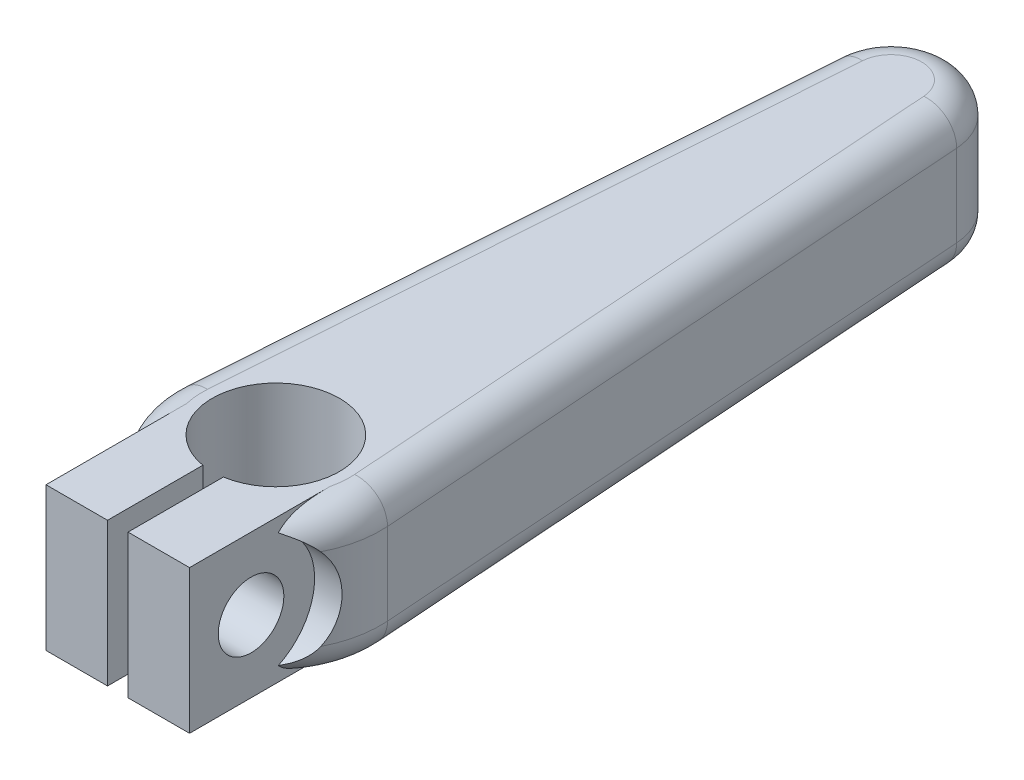
from build123d import *

# Parameters (mm, degrees)
BOSS_EXTRUDE1_DEPTH = 7
SKETCH2_R           = 1.6
CUT_EXTRUDE1_DEPTH  = 35.813215881
SKETCH3_R           = 3.1
CUT_EXTRUDE2_DEPTH  = 35.813215926
SKETCH4_R           = 3.1
CUT_EXTRUDE3_DEPTH  = 35.813215926
FILLET1_R           = 1.5


with BuildPart() as part:
    # Sketch1 → Boss-Extrude1 (new body)
    with BuildSketch(Plane(origin=(0, 0, 0), x_dir=(1, 0, 0), z_dir=(0, 1, 0))):
        with BuildLine():
            Line((3.5, -7.709447398), (3.5, -3.709447398))
            ThreePointArc((3.5, -3.709447398), (4.75081501, -1.85465812), (5.087489656, 0.357))
            Line((5.087489656, 0.357), (2.992640974, 30.21))
            ThreePointArc((2.992640974, 30.21), (0, 33), (-2.992640974, 30.21))
            Line((-2.992640974, 30.21), (-5.087489656, 0.357))
            ThreePointArc((-5.087489656, 0.357), (-4.75081501, -1.85465812), (-3.5, -3.709447398))
            Line((-3.5, -3.709447398), (-3.5, -7.709447398))
            Line((-3.5, -7.709447398), (-0.5, -7.709447398))
            Line((-0.5, -7.709447398), (-0.5, -3.059411708))
            ThreePointArc((-0.5, -3.059411708), (0, 3.1), (0.5, -3.059411708))
            Line((0.5, -3.059411708), (0.5, -7.709447398))
            Line((0.5, -7.709447398), (3.5, -7.709447398))
        make_face()
    extrude(amount=BOSS_EXTRUDE1_DEPTH)

    # Sketch2 → Cut-Extrude1 (cut, through all)
    with BuildSketch(Plane(origin=(3.5, 0, 0), x_dir=(0, 0, -1), z_dir=(1, 0, 0))):
        with Locations((-4.709447398, 3.5)):
            Circle(SKETCH2_R)
    extrude(amount=-CUT_EXTRUDE1_DEPTH, mode=Mode.SUBTRACT)

    # Sketch3 → Cut-Extrude2 (cut, through all)
    with BuildSketch(Plane(origin=(3.5, 0, 0), x_dir=(0, 0, -1), z_dir=(1, 0, 0))):
        with Locations((-4.709447398, 3.5)):
            Circle(SKETCH3_R)
    extrude(amount=CUT_EXTRUDE2_DEPTH, mode=Mode.SUBTRACT)

    # Sketch4 → Cut-Extrude3 (cut, through all)
    with BuildSketch(Plane.ZY.offset(3.5)):
        with Locations((4.709447398, 3.5)):
            Circle(SKETCH4_R)
    extrude(amount=CUT_EXTRUDE3_DEPTH, mode=Mode.SUBTRACT)

    # Fillet1
    # the kernel refuses this fillet: 1.5 mm, written as the material it takes off along each edge
    with BuildSketch(Plane(origin=(0, 0, 0), x_dir=(-0.9975469913743412, 0, -0.06999999999999885), z_dir=(0.06999999999999885, 0, -0.9975469913743412))) as fillet1_piece_1_section:
        with BuildLine():
            CenterArc((5.1 - FILLET1_R, FILLET1_R), FILLET1_R, 270, 90)
            Line((5.1 - FILLET1_R, 0), (5.1, 0))
            Line((5.1, 0), (5.1, FILLET1_R))
        make_face()
    fillet1_piece_1 = revolve(axis=Axis((0, 0, 0), (0, 1, 0)), revolution_arc=92.812679078, mode=Mode.PRIVATE)
    fillet1_piece_1 = split(fillet1_piece_1, bisect_by=Plane(origin=(-3.5, 0.37107605, 1.567580694), z_dir=(-1, 0, 0)), keep=Keep.TOP, mode=Mode.PRIVATE)
    add(fillet1_piece_1, mode=Mode.SUBTRACT)
    with BuildSketch(Plane(origin=(0, 0, 0), x_dir=(0.020965246222385766, 0, 0.9997802050705118), z_dir=(-0.9997802050705118, 0, 0.020965246222385766))) as fillet1_piece_2_section:
        with BuildLine():
            CenterArc((5.1 - FILLET1_R, FILLET1_R), FILLET1_R, 270, 90)
            Line((5.1, FILLET1_R), (5.1, 0))
            Line((5.1, 0), (5.1 - FILLET1_R, 0))
        make_face()
    fillet1_piece_2 = revolve(axis=Axis((0, 0, 0), (0, 1, 0)), revolution_arc=92.812679078, mode=Mode.PRIVATE)
    fillet1_piece_2 = split(fillet1_piece_2, bisect_by=Plane(origin=(3.5, 0.371076241, 1.567580599), z_dir=(1, 0, 0)), keep=Keep.TOP, mode=Mode.PRIVATE)
    add(fillet1_piece_2, mode=Mode.SUBTRACT)
    with BuildSketch(Plane(origin=(5.087489656, 0, -0.357), x_dir=(0, 1, 0), z_dir=(-0.06999999999999998, 0, -0.9975469913743412)), Plane(origin=(-2.992640974, 0, -30.21), x_dir=(0, 1, 0), z_dir=(-0.06999999999999998, 0, 0.9975469913743412)), Plane(origin=(-2.992640974, 7, -30.21), x_dir=(0.9975469913743412, 0, 0.06999999999999998), z_dir=(-0.06999999999999998, 0, 0.9975469913743412))) as fillet1_piece_3:
        with BuildLine():
            CenterArc((FILLET1_R, -FILLET1_R), FILLET1_R, 90, 90)
            Line((0, -FILLET1_R), (0, 0))
            Line((0, 0), (FILLET1_R, 0))
        make_face()
    extrude(amount=29.926409741, mode=Mode.SUBTRACT)
    with BuildSketch(Plane(origin=(0, 0, -30), x_dir=(0.9975469913743412, 0, -0.07000000000000023), z_dir=(0.07000000000000023, 0, 0.9975469913743412))) as fillet1_piece_4:
        with BuildLine():
            CenterArc((3 - FILLET1_R, FILLET1_R), FILLET1_R, 270, 90)
            Line((3, FILLET1_R), (3, 0))
            Line((3, 0), (3 - FILLET1_R, 0))
        make_face()
    revolve(axis=Axis((0, 0, -30), (0, 1, 0)), revolution_arc=171.972025564, mode=Mode.SUBTRACT)
    with BuildSketch(Plane(origin=(0, 7, 0), x_dir=(-0.9975469913743412, 0, -0.06999999999999885), z_dir=(0.06999999999999885, 0, -0.9975469913743412))) as fillet1_piece_5_section:
        with BuildLine():
            CenterArc((5.1 - FILLET1_R, -FILLET1_R), FILLET1_R, 0, 90)
            Line((5.1, -FILLET1_R), (5.1, 0))
            Line((5.1, 0), (5.1 - FILLET1_R, 0))
        make_face()
    fillet1_piece_5 = revolve(axis=Axis((0, 7, 0), (0, 1, 0)), revolution_arc=92.812679078, mode=Mode.PRIVATE)
    fillet1_piece_5 = split(fillet1_piece_5, bisect_by=Plane(origin=(-3.5, 6.628923944, 1.567580643), z_dir=(-1, 0, 0)), keep=Keep.TOP, mode=Mode.PRIVATE)
    add(fillet1_piece_5, mode=Mode.SUBTRACT)
    with BuildSketch(Plane(origin=(0, 7, 0), x_dir=(0.020965246222385686, 0, 0.9997802050705119), z_dir=(-0.9997802050705119, 0, 0.020965246222385686))) as fillet1_piece_6_section:
        with BuildLine():
            CenterArc((5.1 - FILLET1_R, -FILLET1_R), FILLET1_R, 0, 90)
            Line((5.1, -FILLET1_R), (5.1, 0))
            Line((5.1, 0), (5.1 - FILLET1_R, 0))
        make_face()
    fillet1_piece_6 = revolve(axis=Axis((0, 7, 0), (0, 1, 0)), revolution_arc=92.812679078, mode=Mode.PRIVATE)
    fillet1_piece_6 = split(fillet1_piece_6, bisect_by=Plane(origin=(3.5, 6.628923759, 1.567580599), z_dir=(1, 0, 0)), keep=Keep.TOP, mode=Mode.PRIVATE)
    add(fillet1_piece_6, mode=Mode.SUBTRACT)
    with BuildSketch(Plane(origin=(0, 7, -30), x_dir=(0.9975469913743412, 0, -0.07000000000000023), z_dir=(0.07000000000000023, 0, 0.9975469913743412))) as fillet1_piece_7:
        with BuildLine():
            CenterArc((3 - FILLET1_R, -FILLET1_R), FILLET1_R, 0, 90)
            Line((3, -FILLET1_R), (3, 0))
            Line((3, 0), (3 - FILLET1_R, 0))
        make_face()
    revolve(axis=Axis((0, 7, -30), (0, 1, 0)), revolution_arc=171.972025564, mode=Mode.SUBTRACT)
    with BuildSketch(Plane(origin=(5.087489656, 7, -0.357), x_dir=(0, -1, 0), z_dir=(-0.06999999999999998, 0, -0.9975469913743412))) as fillet1_piece_8:
        with BuildLine():
            CenterArc((FILLET1_R, FILLET1_R), FILLET1_R, 180, 90)
            Line((0, FILLET1_R), (0, 0))
            Line((0, 0), (FILLET1_R, 0))
        make_face()
    extrude(amount=29.926409741, mode=Mode.SUBTRACT)


solid = part.part
